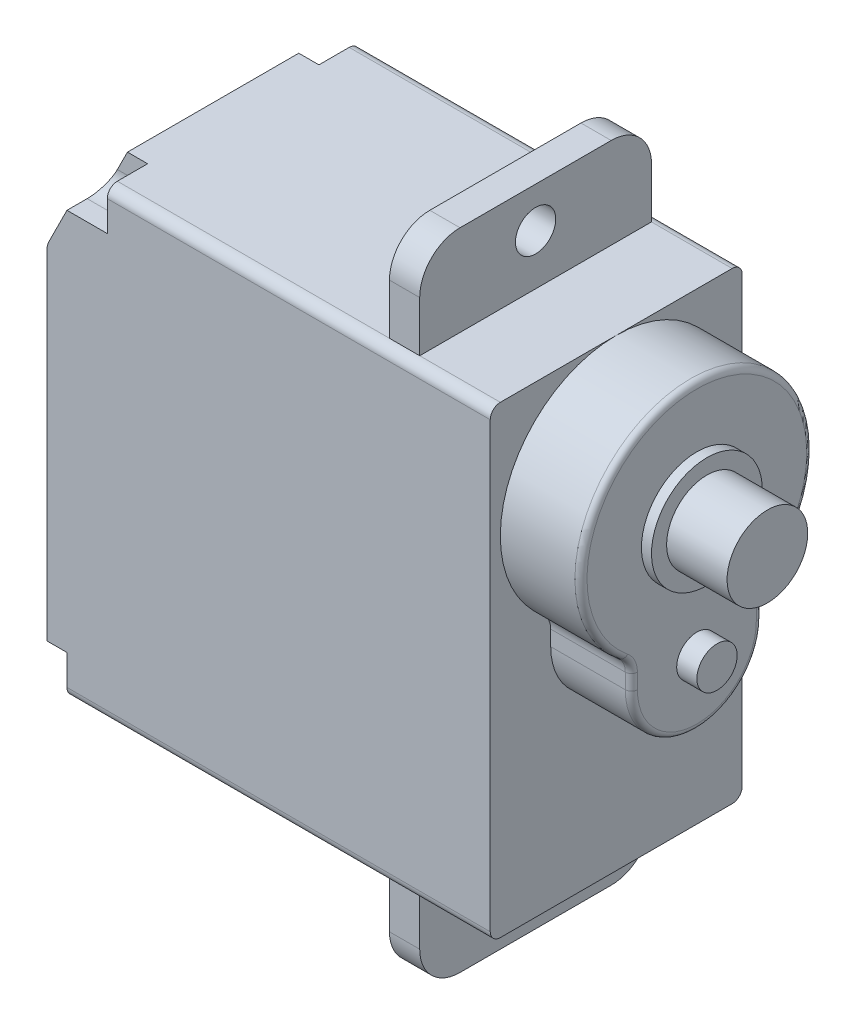
from build123d import *

# Parameters (mm, degrees)
SKETCH1_W           = 22
SKETCH1_H           = 23
EXTRUDE1_DEPTH      = 6.25
EXTRUDE2_DEPTH      = 4
SKETCH3_R           = 2
EXTRUDE3_DEPTH      = 3.5
EXTRUDE4_DEPTH      = 26.11473671
FILLET1_R           = 1
SKETCH5_R           = 1
EXTRUDE5_DEPTH      = 1
SKETCH6_R           = 2.75
EXTRUDE6_DEPTH      = 0.5
EXTRUDE7_DEPTH      = 1
EXTRUDE8_DEPTH      = 33.273247435
EXTRUDE8_DEPTH_BACK = 1
EXTRUDE8_START      = -2
SKETCH8_W           = 1.5
SKETCH8_H           = 4.5
EXTRUDE9_DEPTH      = 5.75
FILLET3_R           = 0.3
FILLET4_R           = 0.5
FILLET5_R           = 2
SKETCH9_R           = 1
EXTRUDE10_DEPTH     = 11.5


with BuildPart() as part:
    # Sketch1 → Extrude1 (new, symmetric)
    with BuildSketch(Plane.XY):
        Rectangle(SKETCH1_W, SKETCH1_H)
    extrude(amount=EXTRUDE1_DEPTH, both=True)

    # Sketch2 → Extrude2 (add)
    with BuildSketch(Plane(origin=(11, 0, 0), x_dir=(0, 0, -1), z_dir=(1, 0, 0))):
        with BuildLine():
            Line((-3.25, -0.25), (-3.25, 1.00658351))
            ThreePointArc((-3.25, 1.00658351), (0, 11.5), (3.25, 1.00658351))
            Line((3.25, 1.00658351), (3.25, -0.25))
            ThreePointArc((3.25, -0.25), (0, -3.5), (-3.25, -0.25))
        make_face()
    extrude(amount=EXTRUDE2_DEPTH)

    # Sketch3 → Extrude3 (add)
    with BuildSketch(Plane(origin=(15, 0, 0), x_dir=(0, 0, -1), z_dir=(1, 0, 0))):
        with Locations(Location((0, 5.75, 0), (0, 0, 90))):
            Circle(SKETCH3_R)
    extrude(amount=EXTRUDE3_DEPTH)

    # Sketch4 → Extrude4 (cut, through all)
    with BuildSketch(Plane.XY.offset(6.25)):
        Polygon((-9, 11.5), (-11, 11.5), (-11, 7.5), align=None)
    extrude(amount=-EXTRUDE4_DEPTH, mode=Mode.SUBTRACT)

    # Fillet1
    fillet1_edges = [part.edges().sort_by_distance(p)[0] for p in [
        (13, 1.00658351, -3.25),
        (13, 1.00658351, 3.25),
        (-11, 7.5, 0),
    ]]
    fillet(fillet1_edges, radius=FILLET1_R)

    # Sketch5 → Extrude5 (add)
    with BuildSketch(Plane(origin=(15, 0, 0), x_dir=(0, 0, -1), z_dir=(1, 0, 0))):
        with Locations(Location((0, -0.25, 0), (0, 0, 90))):
            Circle(SKETCH5_R)
    extrude(amount=EXTRUDE5_DEPTH)

    # Sketch6 → Extrude6 (add)
    with BuildSketch(Plane(origin=(15, 0, 0), x_dir=(0, 0, -1), z_dir=(1, 0, 0))):
        with Locations(Location((0, 5.75, 0), (0, 0, 90))):
            Circle(SKETCH6_R)
    extrude(amount=EXTRUDE6_DEPTH)

    # Sketch7 → Extrude7 (cut)
    with BuildSketch(Plane.ZY.offset(11)):
        with BuildLine():
            Line((-5.25, -9.5), (-6.25, -9.5))
            Line((-6.25, -9.5), (-6.25, -11.5))
            Line((-6.25, -11.5), (-4.25, -11.5))
            Line((-4.25, -11.5), (-4.25, -10.5))
            ThreePointArc((-4.25, -10.5), (-4.542893219, -9.792893219), (-5.25, -9.5))
        make_face()
        with BuildLine():
            Line((6.25, -11.5), (4.25, -11.5))
            Line((4.25, -11.5), (4.25, -10.5))
            ThreePointArc((4.25, -10.5), (4.542893219, -9.792893219), (5.25, -9.5))
            Line((5.25, -9.5), (6.25, -9.5))
            Line((6.25, -9.5), (6.25, -11.5))
        make_face()
        with BuildLine():
            Line((5.25, 9.5), (6.25, 9.5))
            Line((6.25, 9.5), (6.25, 11.5))
            Line((6.25, 11.5), (4.25, 11.5))
            Line((4.25, 11.5), (4.25, 10.5))
            ThreePointArc((4.25, 10.5), (4.542893219, 9.792893219), (5.25, 9.5))
        make_face()
        with BuildLine():
            Line((-6.25, 11.5), (-4.25, 11.5))
            Line((-4.25, 11.5), (-4.25, 10.5))
            ThreePointArc((-4.25, 10.5), (-4.542893219, 9.792893219), (-5.25, 9.5))
            Line((-5.25, 9.5), (-6.25, 9.5))
            Line((-6.25, 9.5), (-6.25, 11.5))
        make_face()
    extrude(amount=-EXTRUDE7_DEPTH, mode=Mode.SUBTRACT)

    # Sketch → Extrude8 (cut, two sides: drawn at the far end of the back side and taken through both)
    with BuildSketch(Plane.ZY.offset(11).offset(EXTRUDE8_START - EXTRUDE8_DEPTH_BACK)):
        with BuildLine():
            ThreePointArc((-4.25, 10.5), (-4.542893219, 9.792893219), (-5.25, 9.5))
            Line((-5.25, 9.5), (-6.25, 9.5))
            Line((-6.25, 9.5), (-6.25, 11.5))
            Line((-6.25, 11.5), (-4.25, 11.5))
            Line((-4.25, 11.5), (-4.25, 10.5))
        make_face()
        with BuildLine():
            Line((4.25, 10.5), (4.25, 11.5))
            Line((4.25, 11.5), (6.25, 11.5))
            Line((6.25, 11.5), (6.25, 9.5))
            Line((6.25, 9.5), (5.25, 9.5))
            ThreePointArc((5.25, 9.5), (4.542893219, 9.792893219), (4.25, 10.5))
        make_face()
    extrude(amount=EXTRUDE8_DEPTH + EXTRUDE8_DEPTH_BACK, mode=Mode.SUBTRACT)

    # Sketch8 → Extrude9 (add, symmetric)
    with BuildSketch(Plane.XY):
        with Locations((6.25, 13.75)):
            Rectangle(SKETCH8_W, SKETCH8_H)
        with Locations((6.25, -13.75)):
            Rectangle(SKETCH8_W, SKETCH8_H)
    extrude(amount=EXTRUDE9_DEPTH, both=True)

    # Fillet3
    fillet3_edges = [part.edges().sort_by_distance(p)[0] for p in [
        (15, -3.5, 0),
        (15, 0.12797788, -3.25),
        (15, 11.5, 0),
        (15, 0.12797788, 3.25),
        (15, 0.936287242, -3.347329066),
        (15, 0.936287242, 3.347329066),
    ]]
    fillet(fillet3_edges, radius=FILLET3_R)

    # Fillet4
    fillet4_edges = [part.edges().sort_by_distance(p)[0] for p in [
        (1.5, 11.5, -6.25),
        (1.5, 11.5, 6.25),
        (0.5, -11.5, -6.25),
        (0.5, -11.5, 6.25),
    ]]
    fillet(fillet4_edges, radius=FILLET4_R - 0.0001)  # a hair under: the kernel refuses the full size

    # Fillet5
    fillet5_edges = [part.edges().sort_by_distance(p)[0] for p in [
        (6.25, 16, -5.75),
        (6.25, 16, 5.75),
        (6.25, -16, -5.75),
        (6.25, -16, 5.75),
    ]]
    fillet(fillet5_edges, radius=FILLET5_R)

    # Sketch9 → Extrude10 (cut)
    with BuildSketch(Plane(origin=(7, 0, 0), x_dir=(0, 0, -1), z_dir=(1, 0, 0))):
        with Locations((0, 14)):
            Circle(SKETCH9_R)
    extrude10 = extrude(amount=-EXTRUDE10_DEPTH, mode=Mode.SUBTRACT)

    # Mirror1: Extrude10 across plane
    add(extrude10.mirror(Plane.ZX), mode=Mode.SUBTRACT)


solid = part.part
